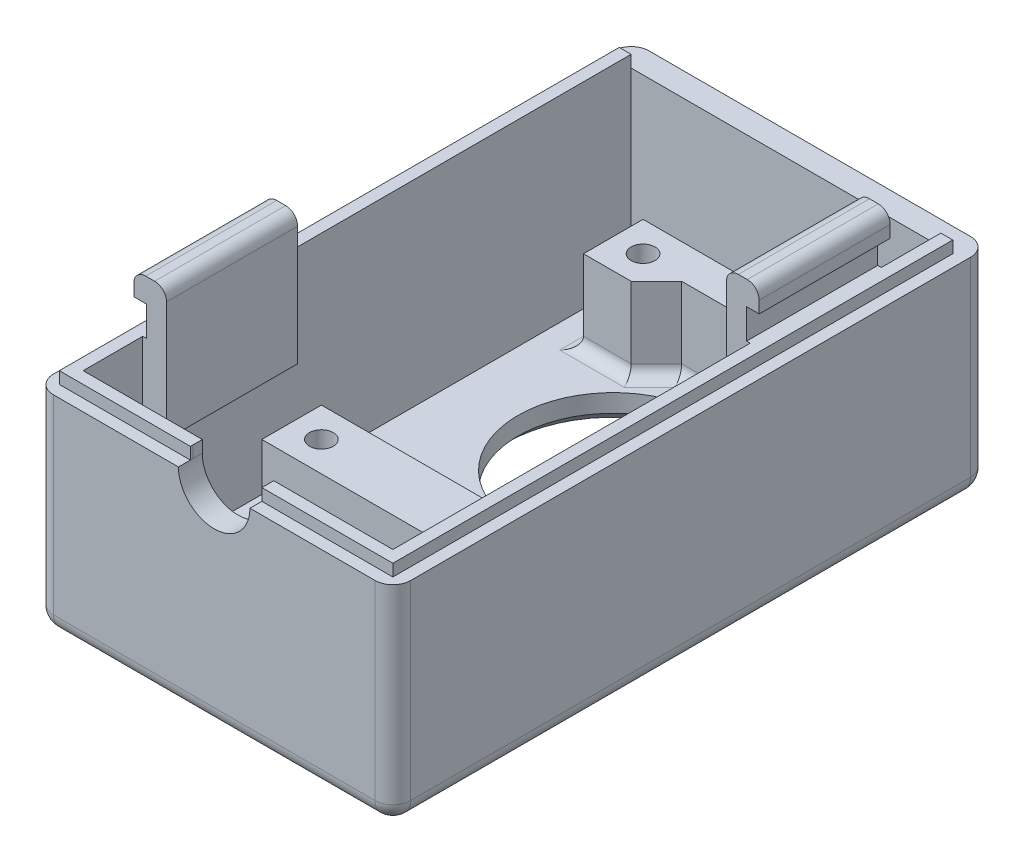
from build123d import *

# Parameters (mm, degrees)
BOSS_EXTRUDE1_DEPTH  = 17.5
CUT_EXTRUDE1_DEPTH   = 15.5
CUT_EXTRUDE3_REACH   = 38.949
SKETCH4_R            = 8
SKETCH4_4_R          = 1
SKETCH4_4_W          = 20
SKETCH4_4_H          = 5
BOSS_EXTRUDE2_DEPTH  = 7
FILLET1_R            = 1
FILLET2_R            = 1.5
BOSS_EXTRUDE3_DEPTH  = 2
SKETCH6_W            = 11
SKETCH6_H            = 2
BOSS_EXTRUDE4_DEPTH  = 0.75
SKETCH11_R           = 8
BOSS_EXTRUDE11_DEPTH = 0.5
SKETCH14_W           = 11
SKETCH14_H           = 11
BOSS_EXTRUDE12_DEPTH = 2
BOSS_EXTRUDE13_DEPTH = 1
SKETCH6_4_W          = 11
SKETCH6_4_H          = 2.5
CUT_EXTRUDE6_DEPTH   = 0.3
SKETCH16_W           = 11
SKETCH16_H           = 2
BOSS_EXTRUDE14_DEPTH = 0.75
SKETCH16_3_W         = 11
SKETCH16_3_H         = 2.5
CUT_EXTRUDE7_DEPTH   = 0.3
CUT_EXTRUDE8_REACH   = 59.044
FILLET3_R            = 1
CHAMFER1_SIZE        = 0.5
CHAMFER3_SIZE        = 1


with BuildPart() as part:
    # Sketch1 → Boss-Extrude1 (new body)
    with BuildSketch(Plane(origin=(0, 0, 0), x_dir=(1, 0, 0), z_dir=(0, 1, 0))):
        Polygon((-15, 20), (15, 20), (15, -20), (15, -30), (-15, -30), (-15, -20), align=None)
    extrude(amount=BOSS_EXTRUDE1_DEPTH)

    # Sketch2 → Cut-Extrude1 (cut)
    with BuildSketch(Plane(origin=(0, 17.5, 0), x_dir=(1, 0, 0), z_dir=(0, 1, 0))):
        Polygon((-13, 18), (13, 18), (13, -18), (13, -28), (-13, -28), (-13, -18), align=None)
    extrude(amount=-CUT_EXTRUDE1_DEPTH, mode=Mode.SUBTRACT)

    # Sketch4 → Cut-Extrude3 (cut, up to next)
    with BuildSketch(Plane(origin=(0, 2, 0), x_dir=(1, 0, 0), z_dir=(0, 1, 0)), mode=Mode.PRIVATE) as cut_extrude3_sk1:
        with Locations(Location((0, 3.5, 0), (0, 0, 270))):
            Circle(SKETCH4_R)
    cut_extrude3_tool1 = extrude(cut_extrude3_sk1.sketch, amount=-CUT_EXTRUDE3_REACH, mode=Mode.PRIVATE) & part.part
    add(cut_extrude3_tool1.solids().sort_by_distance((0, 2, -3.5))[0], mode=Mode.SUBTRACT)

    # Sketch4<4> → Boss-Extrude2 (add)
    # profile 1 of 2: a face of its own
    with BuildSketch(Plane(origin=(0, 2, 0), x_dir=(1, 0, 0), z_dir=(0, 1, 0))):
        Polygon((10, 16), (-10, 16), (-10, 11), (-5.998750655, 11), (-3.877430311, 13.121320344), (3.877430311, 13.121320344), (5.998750655, 11), (10, 11), align=None)
        with Locations(Location((-7.5, 13.5, 0), (0, 0, 270))):
            Circle(SKETCH4_4_R, mode=Mode.SUBTRACT)
        with Locations(Location((7.5, 13.5, 0), (0, 0, 270))):
            Circle(SKETCH4_4_R, mode=Mode.SUBTRACT)
    # profile 2 of 2: a face of its own
    with BuildSketch(Plane(origin=(0, 2, 0), x_dir=(1, 0, 0), z_dir=(0, 1, 0))):
        with Locations((0, -13.5)):
            Rectangle(SKETCH4_4_W, SKETCH4_4_H)
        with Locations(Location((7.5, -13.5, 0), (0, 0, 270))):
            Circle(SKETCH4_4_R, mode=Mode.SUBTRACT)
        with Locations(Location((-7.5, -13.5, 0), (0, 0, 270))):
            Circle(SKETCH4_4_R, mode=Mode.SUBTRACT)
    extrude(amount=BOSS_EXTRUDE2_DEPTH)

    # Fillet1
    fillet1_edges = [part.edges().sort_by_distance(p)[0] for p in [
        (-4.938090483, 2, -12.060660172),
        (0, 2, -13.121320344),
        (-10, 2, -13.5),
        (-7.999375327, 2, -11),
        (0, 2, -16),
        (10, 2, -13.5),
        (7.999375327, 2, -11),
        (4.938090483, 2, -12.060660172),
        (-10, 2, 13.5),
        (0, 2, 16),
        (0, 2, 11),
        (10, 2, 13.5),
    ]]
    fillet(fillet1_edges, radius=FILLET1_R)

    # Fillet2
    fillet2_edges = [part.edges().sort_by_distance(p)[0] for p in [
        (15, 8.75, 30),
        (-15, 8.75, 30),
        (-15, 8.75, -20),
        (15, 8.75, -20),
        (0, 0, 30),
        (-15, 0, 5),
        (0, 0, -20),
        (15, 0, 5),
    ]]
    fillet(fillet2_edges, radius=FILLET2_R)

    # Sketch5 → Boss-Extrude3 (add)
    with BuildSketch(Plane(origin=(-13, 0, 0), x_dir=(0, 0, -1), z_dir=(1, 0, 0))):
        Polygon((-12, 17.5), (-18, 17.5), (-23, 17.5), (-23, 12), (-12, 12), align=None)
        Polygon((-23, 17.5), (-18, 17.5), (-12, 17.5), (-12, 23), (-23, 23), align=None)
    extrude(amount=BOSS_EXTRUDE3_DEPTH)

    # Sketch6 → Boss-Extrude4 (add)
    with BuildSketch(Plane.ZY.offset(13)):
        with Locations((17.5, 22)):
            Rectangle(SKETCH6_W, SKETCH6_H)
    extrude(amount=BOSS_EXTRUDE4_DEPTH)

    # Sketch11 → Boss-Extrude11 (add)
    with BuildSketch(Plane.XZ):
        Polygon((-12, 17), (-12, -17), (12, -17), (12, 17), (12, 27), (-12, 27), align=None)
        with Locations(Location((0, -3.5, 0), (0, 0, 90))):
            Circle(SKETCH11_R, mode=Mode.SUBTRACT)
    extrude(amount=BOSS_EXTRUDE11_DEPTH)

    # Sketch14 → Boss-Extrude12 (add)
    with BuildSketch(Plane.ZY.offset(-13)):
        with Locations((-7.5, 17.5)):
            Rectangle(SKETCH14_W, SKETCH14_H)
    extrude(amount=BOSS_EXTRUDE12_DEPTH)

    # Sketch15 → Boss-Extrude13 (add)
    with BuildSketch(Plane(origin=(0, 17.5, 0), x_dir=(1, 0, 0), z_dir=(0, 1, 0))):
        with BuildLine():
            Line((-13, -28), (-13, 18))
            Line((-13, 18), (-14, 18))
            Line((-14, 18), (-14, -29))
            Line((-14, -29), (-3, -29))
            ThreePointArc((-3, -29), (-2.998349642, -28.900504153), (-2.993400384, -28.801117774))
            Line((-2.993400384, -28.801117774), (-2.993400384, -28))
            Line((-2.993400384, -28), (-13, -28))
        make_face()
        Polygon((14, 18), (13, 18), (13, -28), (3, -28), (3, -29), (14, -29), align=None)
    extrude(amount=BOSS_EXTRUDE13_DEPTH)

    # Sketch6<4> → Cut-Extrude6 (cut)
    with BuildSketch(Plane.ZY.offset(13)):
        with Locations((17.5, 19.75)):
            Rectangle(SKETCH6_4_W, SKETCH6_4_H)
    extrude(amount=-CUT_EXTRUDE6_DEPTH, mode=Mode.SUBTRACT)

    # Sketch16 → Boss-Extrude14 (add)
    with BuildSketch(Plane(origin=(13, 0, 0), x_dir=(0, 0, -1), z_dir=(1, 0, 0))):
        with Locations((7.5, 22)):
            Rectangle(SKETCH16_W, SKETCH16_H)
    extrude(amount=BOSS_EXTRUDE14_DEPTH)

    # Sketch16<3> → Cut-Extrude7 (cut)
    with BuildSketch(Plane(origin=(13, 0, 0), x_dir=(0, 0, -1), z_dir=(1, 0, 0))):
        with Locations((7.5, 19.75)):
            Rectangle(SKETCH16_3_W, SKETCH16_3_H)
    extrude(amount=-CUT_EXTRUDE7_DEPTH, mode=Mode.SUBTRACT)

    # Sketch17 → Cut-Extrude8 (cut, up to next)
    with BuildSketch(Plane.XY.offset(30), mode=Mode.PRIVATE) as cut_extrude8_sk1:
        with BuildLine():
            Line((-3, 17.5), (3, 17.5))
            ThreePointArc((3, 17.5), (0, 14.5), (-3, 17.5))
        make_face()
    cut_extrude8_tool1 = extrude(cut_extrude8_sk1.sketch, amount=-CUT_EXTRUDE8_REACH, mode=Mode.PRIVATE) & part.part
    add(cut_extrude8_tool1.solids().sort_by_distance((0, 16.22676, 30))[0], mode=Mode.SUBTRACT)

    # Fillet3
    fillet3_edges = [part.edges().sort_by_distance(p)[0] for p in [
        (-11, 23, 17.5),
        (-13.75, 23, 17.5),
        (11, 23, -7.5),
        (13.75, 23, -7.5),
    ]]
    fillet(fillet3_edges, radius=FILLET3_R)

    # Chamfer1
    chamfer1_edges = [part.edges().sort_by_distance(p)[0] for p in [
        (0, -0.5, 27),
        (12, -0.5, 5),
        (-12, -0.5, 5),
        (0, -0.5, -17),
    ]]
    chamfer(chamfer1_edges, length=CHAMFER1_SIZE - 0.0001)  # a hair under: the kernel refuses the full size

    # Chamfer3
    chamfer3_edges = [part.edges().sort_by_distance(p)[0] for p in [
        (0, -0.5, -11.5),
    ]]
    chamfer(chamfer3_edges, length=CHAMFER3_SIZE)


solid = part.part
